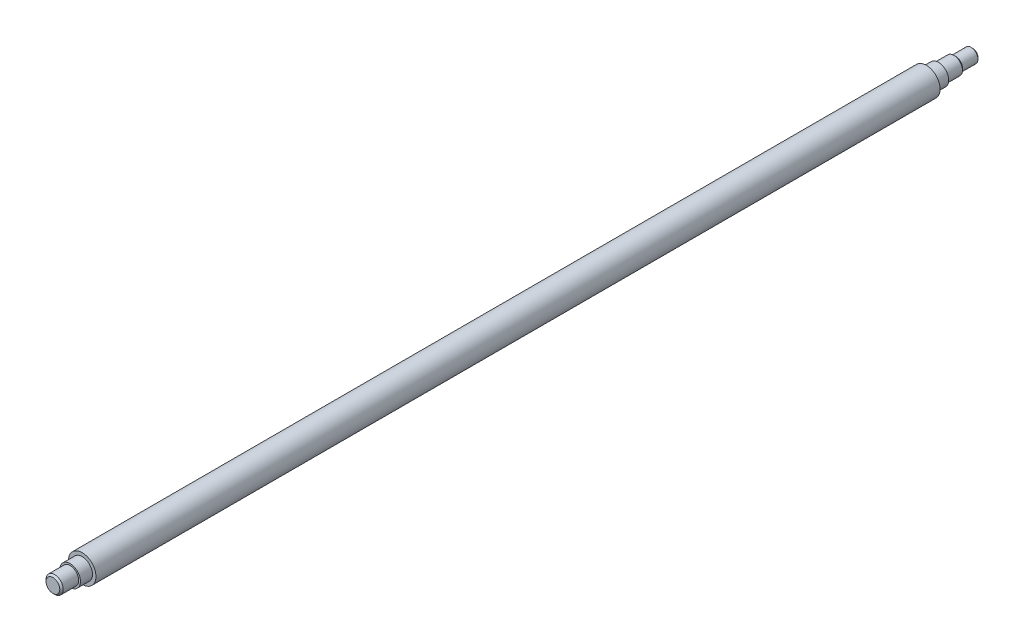
from build123d import *

# Parameters (mm, degrees)
SKETCH1_R           = 8
BOSS_EXTRUDE1_DEPTH = 490
SKETCH6_R           = 6
BOSS_EXTRUDE2_DEPTH = 5
SKETCH7_R           = 6
BOSS_EXTRUDE3_DEPTH = 2
SKETCH8_R           = 5
BOSS_EXTRUDE4_DEPTH = 10
SKETCH9_R           = 4
BOSS_EXTRUDE5_DEPTH = 10
CHAMFER1_SIZE       = 1
CHAMFER2_SIZE       = 1
BOSS_EXTRUDE6_START = 5
SKETCH10_R          = 6
BOSS_EXTRUDE6_DEPTH = 5
BOSS_EXTRUDE7_START = 2
SKETCH11_R          = 6
BOSS_EXTRUDE7_DEPTH = 2
BOSS_EXTRUDE8_START = 10
SKETCH12_R          = 5
BOSS_EXTRUDE8_DEPTH = 10
CHAMFER3_SIZE       = 1


with BuildPart() as part:
    # Sketch1 → Boss-Extrude1 (new body)
    with BuildSketch(Plane.XY):
        Circle(SKETCH1_R)
    extrude(amount=BOSS_EXTRUDE1_DEPTH)

    # Sketch6 → Boss-Extrude2 (add)
    with BuildSketch(Plane(origin=(0, 0, 0), x_dir=(-1, 0, 0), z_dir=(0, 0, -1))):
        with Locations(Location((0, 0, 0), (0, 0, 180))):
            Circle(SKETCH6_R)
    extrude(amount=BOSS_EXTRUDE2_DEPTH)

    # Sketch7 → Boss-Extrude3 (add)
    with BuildSketch(Plane(origin=(0, 0, -5), x_dir=(-1, 0, 0), z_dir=(0, 0, -1))):
        with Locations(Location((0, 0, 0), (0, 0, 180))):
            Circle(SKETCH7_R)
    extrude(amount=BOSS_EXTRUDE3_DEPTH)

    # Sketch8 → Boss-Extrude4 (add)
    with BuildSketch(Plane(origin=(0, 0, -7), x_dir=(-1, 0, 0), z_dir=(0, 0, -1))):
        Circle(SKETCH8_R)
    extrude(amount=BOSS_EXTRUDE4_DEPTH)

    # Sketch9 → Boss-Extrude5 (add)
    with BuildSketch(Plane(origin=(0, 0, -17), x_dir=(-1, 0, 0), z_dir=(0, 0, -1))):
        Circle(SKETCH9_R)
    extrude(amount=BOSS_EXTRUDE5_DEPTH)

    # Chamfer1
    chamfer1_edges = [part.edges().sort_by_distance(p)[0] for p in [
        (5, 0, -17),
    ]]
    chamfer(chamfer1_edges, length=CHAMFER1_SIZE - 0.0001)  # a hair under: the kernel refuses the full size

    # Chamfer2
    chamfer2_edges = [part.edges().sort_by_distance(p)[0] for p in [
        (4, 0, -27),
    ]]
    chamfer(chamfer2_edges, length=CHAMFER2_SIZE)

    # Sketch10 → Boss-Extrude6 (add)
    with BuildSketch(Plane.XY.offset(490).offset(BOSS_EXTRUDE6_START)):
        Circle(SKETCH10_R)
    extrude(amount=-BOSS_EXTRUDE6_DEPTH)

    # Sketch11 → Boss-Extrude7 (add)
    with BuildSketch(Plane.XY.offset(495).offset(BOSS_EXTRUDE7_START)):
        Circle(SKETCH11_R)
    extrude(amount=-BOSS_EXTRUDE7_DEPTH)

    # Sketch12 → Boss-Extrude8 (add)
    with BuildSketch(Plane.XY.offset(497).offset(BOSS_EXTRUDE8_START)):
        with Locations(Location((0, 0, 0), (0, 0, 180))):
            Circle(SKETCH12_R)
    extrude(amount=-BOSS_EXTRUDE8_DEPTH)

    # Chamfer3
    chamfer3_edges = [part.edges().sort_by_distance(p)[0] for p in [
        (5, 0, 507),
    ]]
    chamfer(chamfer3_edges, length=CHAMFER3_SIZE)


solid = part.part
